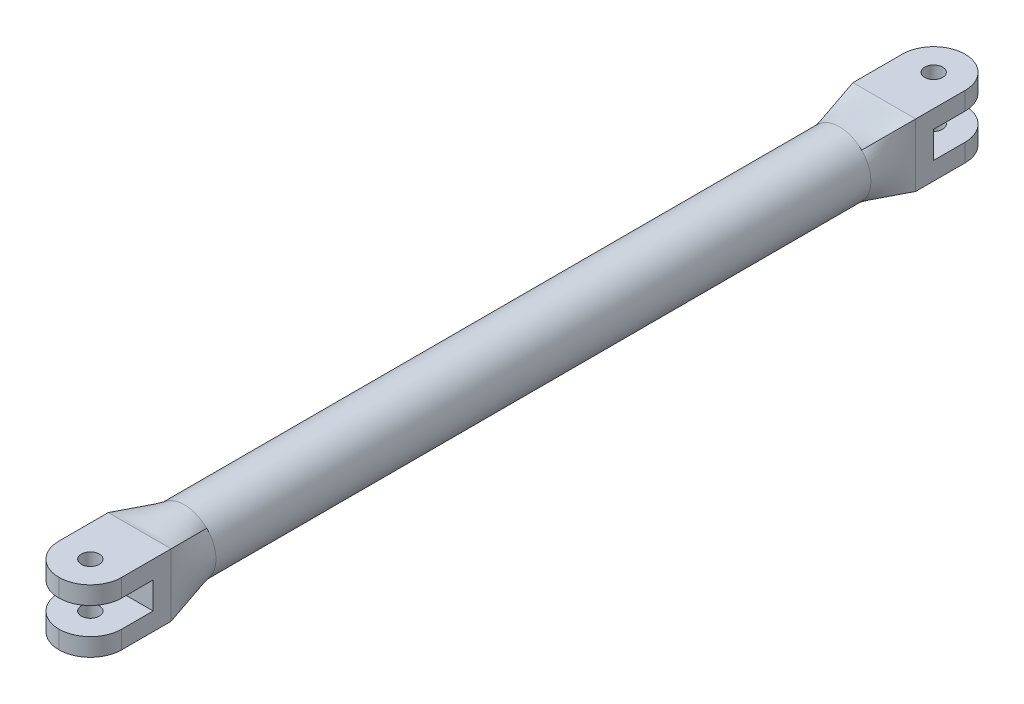
from build123d import *

# Parameters (mm, degrees)
SKETCH1_R           = 3.5
BOSS_EXTRUDE1_DEPTH = 65.5
SKETCH3_2_W         = 7
SKETCH3_2_H         = 7
BOSS_EXTRUDE3_DEPTH = 2
SKETCH4_W           = 7
SKETCH4_H           = 2
BOSS_EXTRUDE2_DEPTH = 7
SKETCH5_R           = 1
CUT_EXTRUDE1_DEPTH  = 80.884291435
FILLET1_R           = 3.5


with BuildPart() as part:
    # Sketch1 → Boss-Extrude1 (new body)
    with BuildSketch(Plane.XY):
        Circle(SKETCH1_R)
    extrude(amount=-BOSS_EXTRUDE1_DEPTH)

    # Loft1: read off the stored shape, not the designer's step
    # Loft1: loft between two sections, ruled curve by curve
    loft1_from = [
        Edge.make_bspline([(-3.5, 3.5, -70.5), (-3.5, 2.916666667, -70.5), (-3.5, 2.333333333, -70.5), (-3.5, 1.166666667, -70.5), (-3.5, 0.583333333, -70.5), (-3.5, -0.583333333, -70.5), (-3.5, -1.166666667, -70.5), (-3.5, -2.333333333, -70.5), (-3.5, -2.916666667, -70.5), (-3.5, -3.5, -70.5)], [0, 0, 0, 0, 0.25, 0.25, 0.5, 0.5, 0.75, 0.75, 1, 1, 1, 1], 3),
        Edge.make_bspline([(-3.5, -3.5, -70.5), (-2.916666667, -3.5, -70.5), (-2.333333333, -3.5, -70.5), (-1.166666667, -3.5, -70.5), (-0.583333333, -3.5, -70.5), (0.583333333, -3.5, -70.5), (1.166666667, -3.5, -70.5), (2.333333333, -3.5, -70.5), (2.916666667, -3.5, -70.5), (3.5, -3.5, -70.5)], [0, 0, 0, 0, 0.25, 0.25, 0.5, 0.5, 0.75, 0.75, 1, 1, 1, 1], 3),
        Edge.make_bspline([(3.5, 3.5, -70.5), (2.916666667, 3.5, -70.5), (2.333333333, 3.5, -70.5), (1.166666667, 3.5, -70.5), (0.583333333, 3.5, -70.5), (-0.583333333, 3.5, -70.5), (-1.166666667, 3.5, -70.5), (-2.333333333, 3.5, -70.5), (-2.916666667, 3.5, -70.5), (-3.5, 3.5, -70.5)], [0, 0, 0, 0, 0.25, 0.25, 0.5, 0.5, 0.75, 0.75, 1, 1, 1, 1], 3),
        Edge.make_bspline([(3.5, -3.5, -70.5), (3.5, -2.916666667, -70.5), (3.5, -2.333333333, -70.5), (3.5, -1.166666667, -70.5), (3.5, -0.583333333, -70.5), (3.5, 0.583333333, -70.5), (3.5, 1.166666667, -70.5), (3.5, 2.333333333, -70.5), (3.5, 2.916666667, -70.5), (3.5, 3.5, -70.5)], [0, 0, 0, 0, 0.25, 0.25, 0.5, 0.5, 0.75, 0.75, 1, 1, 1, 1], 3),
    ]
    loft1_to = [
        Edge.make_bspline([(-2.474873734, 2.474873734, -65.5), (-2.766540401, 2.183207067, -65.5), (-3.028055087, 1.815378049, -65.5), (-3.396138059, 0.964863384, -65.5), (-3.5, 0.483249156, -65.5), (-3.5, -0.483249156, -65.5), (-3.396138059, -0.964863384, -65.5), (-3.028055087, -1.815378049, -65.5), (-2.766540401, -2.183207067, -65.5), (-2.474873734, -2.474873734, -65.5)], [0, 0, 0, 0, 0.25, 0.25, 0.5, 0.5, 0.75, 0.75, 1, 1, 1, 1], 3),
        Edge.make_bspline([(-2.474873734, -2.474873734, -65.5), (-2.183207067, -2.766540401, -65.5), (-1.815378049, -3.028055087, -65.5), (-0.964863384, -3.396138059, -65.5), (-0.483249156, -3.5, -65.5), (0.483249156, -3.5, -65.5), (0.964863384, -3.396138059, -65.5), (1.815378049, -3.028055087, -65.5), (2.183207067, -2.766540401, -65.5), (2.474873734, -2.474873734, -65.5)], [0, 0, 0, 0, 0.25, 0.25, 0.5, 0.5, 0.75, 0.75, 1, 1, 1, 1], 3),
        Edge.make_bspline([(2.474873734, 2.474873734, -65.5), (2.183207067, 2.766540401, -65.5), (1.815378049, 3.028055087, -65.5), (0.964863384, 3.396138059, -65.5), (0.483249156, 3.5, -65.5), (-0.483249156, 3.5, -65.5), (-0.964863384, 3.396138059, -65.5), (-1.815378049, 3.028055087, -65.5), (-2.183207067, 2.766540401, -65.5), (-2.474873734, 2.474873734, -65.5)], [0, 0, 0, 0, 0.25, 0.25, 0.5, 0.5, 0.75, 0.75, 1, 1, 1, 1], 3),
        Edge.make_bspline([(2.474873734, -2.474873734, -65.5), (2.766540401, -2.183207067, -65.5), (3.028055087, -1.815378049, -65.5), (3.396138059, -0.964863384, -65.5), (3.5, -0.483249156, -65.5), (3.5, 0.483249156, -65.5), (3.396138059, 0.964863384, -65.5), (3.028055087, 1.815378049, -65.5), (2.766540401, 2.183207067, -65.5), (2.474873734, 2.474873734, -65.5)], [0, 0, 0, 0, 0.25, 0.25, 0.5, 0.5, 0.75, 0.75, 1, 1, 1, 1], 3),
    ]
    loft1 = Solid(Shell([*[Face.make_surface_from_curves(loft1_from[k], loft1_to[k]) for k in range(4)], Face(Wire(loft1_from)), Face(Wire(loft1_to))]))
    add(loft1)

    # Sketch3<2> → Boss-Extrude3 (add)
    with BuildSketch(Plane(origin=(0, 0, -70.5), x_dir=(-1, 0, 0), z_dir=(0, 0, -1))):
        Rectangle(SKETCH3_2_W, SKETCH3_2_H)
    extrude(amount=BOSS_EXTRUDE3_DEPTH)

    # Sketch4 → Boss-Extrude2 (add)
    with BuildSketch(Plane(origin=(0, 0, -72.5), x_dir=(-1, 0, 0), z_dir=(0, 0, -1))):
        with Locations((0, 2.5)):
            Rectangle(SKETCH4_W, SKETCH4_H)
        with Locations((0, -2.5)):
            Rectangle(SKETCH4_W, SKETCH4_H)
    extrude(amount=BOSS_EXTRUDE2_DEPTH)

    # Sketch5 → Cut-Extrude1 (cut, through all)
    with BuildSketch(Plane(origin=(0, 3.5, 0), x_dir=(1, 0, 0), z_dir=(0, 1, 0))):
        with Locations(Location((0, 76, 0), (0, 0, 270))):
            Circle(SKETCH5_R)
    extrude(amount=-CUT_EXTRUDE1_DEPTH, mode=Mode.SUBTRACT)

    # Fillet1
    fillet1_edges = [part.edges().sort_by_distance(p)[0] for p in [
        (-3.5, -2.5, -79.5),
        (-3.5, 2.5, -79.5),
        (3.5, -2.5, -79.5),
        (3.5, 2.5, -79.5),
    ]]
    fillet(fillet1_edges, radius=FILLET1_R - 0.0001)  # a hair under: the kernel refuses the full size

    # Mirror6: part across plane


with BuildPart() as part_1:
    add(part.part)
    add(part.part.mirror(Plane.XY.offset(-29)))


solid = part_1.part
